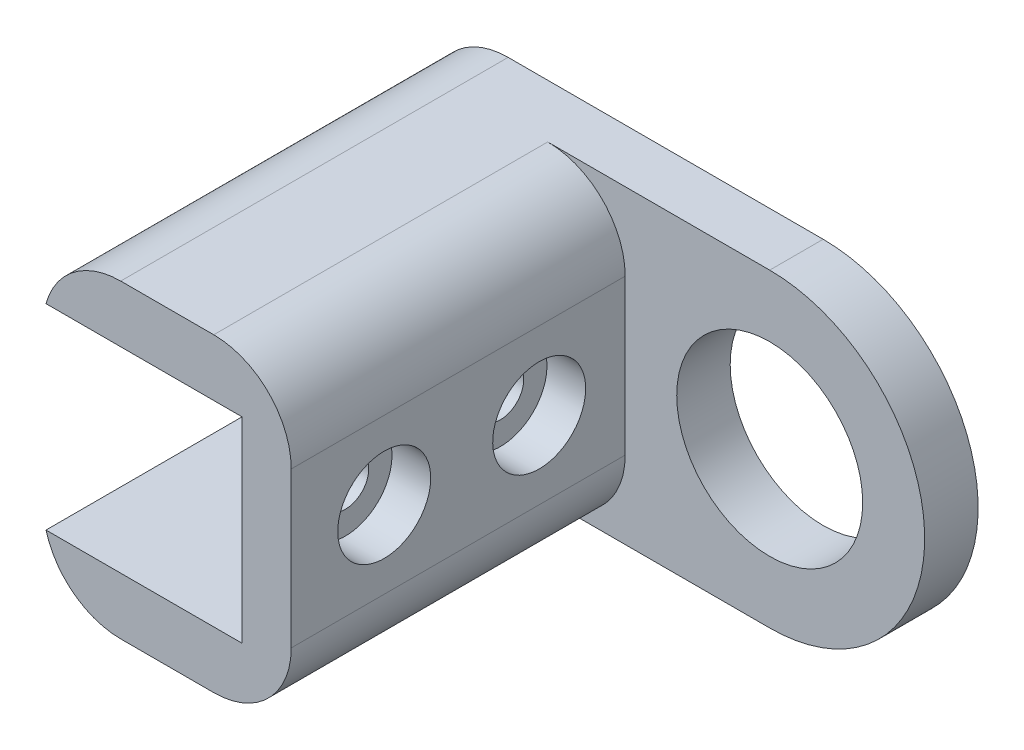
from build123d import *

# Parameters (mm, degrees)
SKETCH1_R           = 6
BOSS_EXTRUDE1_DEPTH = 3.45
SKETCH2_W           = 3.175
SKETCH2_H           = 20
BOSS_EXTRUDE2_DEPTH = 21.55
SKETCH3_W           = 25
SKETCH3_H           = 3.675
BOSS_EXTRUDE3_DEPTH = 12.65
FILLET1_R           = 5
SKETCH5_R           = 1.5
CUT_EXTRUDE1_DEPTH  = 12.65
SKETCH6_R           = 3
CUT_EXTRUDE2_DEPTH  = 2.5
FILLET2_R           = 5


with BuildPart() as part:
    # Sketch1 → Boss-Extrude1 (new body)
    with BuildSketch(Plane.XY):
        with BuildLine():
            Line((0, 10), (-12.5, 10))
            Line((-12.5, 10), (-12.5, -10))
            Line((-12.5, -10), (0, -10))
            ThreePointArc((0, -10), (10, 0), (0, 10))
        make_face()
        with Locations(Location((0, 0, 0), (0, 0, 180))):
            Circle(SKETCH1_R, mode=Mode.SUBTRACT)
    extrude(amount=BOSS_EXTRUDE1_DEPTH)

    # Sketch2 → Boss-Extrude2 (add)
    with BuildSketch(Plane.XY.offset(3.45)):
        with Locations((-10.9125, 0)):
            Rectangle(SKETCH2_W, SKETCH2_H)
    extrude(amount=BOSS_EXTRUDE2_DEPTH)

    # Sketch3 → Boss-Extrude3 (add)
    with BuildSketch(Plane.ZY.offset(12.5)):
        with Locations((12.5, 8.1625)):
            Rectangle(SKETCH3_W, SKETCH3_H)
        with Locations((12.5, -8.1625)):
            Rectangle(SKETCH3_W, SKETCH3_H)
    extrude(amount=BOSS_EXTRUDE3_DEPTH)

    # Fillet1
    fillet1_edges = [part.edges().sort_by_distance(p)[0] for p in [
        (-9.325, 10, 14.225),
        (-9.325, -10, 14.225),
    ]]
    fillet(fillet1_edges, radius=FILLET1_R)

    # Sketch5 → Cut-Extrude1 (cut)
    with BuildSketch(Plane(origin=(-9.325, 0, 0), x_dir=(0, 0, -1), z_dir=(1, 0, 0))):
        with Locations(Location((-19, 0, 0), (0, 0, 90))):
            Circle(SKETCH5_R)
        with Locations(Location((-9, 0, 0), (0, 0, 90))):
            Circle(SKETCH5_R)
    extrude(amount=-CUT_EXTRUDE1_DEPTH, mode=Mode.SUBTRACT)

    # Sketch6 → Cut-Extrude2 (cut)
    with BuildSketch(Plane(origin=(-9.325, 0, 0), x_dir=(0, 0, -1), z_dir=(1, 0, 0))):
        with Locations(Location((-19, 0, 0), (0, 0, 90))):
            Circle(SKETCH6_R)
        with Locations(Location((-9, 0, 0), (0, 0, 90))):
            Circle(SKETCH6_R)
    extrude(amount=-CUT_EXTRUDE2_DEPTH, mode=Mode.SUBTRACT)

    # Fillet2
    # the kernel refuses this fillet: 5 mm, written as the material it takes off along each edge
    with BuildSketch(Plane(origin=(-25.15, 10, 37.05310515), x_dir=(1, 0, 0), z_dir=(0, 0, -1))) as fillet2_piece_1:
        with BuildLine():
            CenterArc((4.82124206, 5), FILLET2_R, 195.366952798, 74.633047202)
            Line((0, 3.675), (-0.096424841, 3.6485))
            ThreePointArc((-0.096424841, 3.6485), (-0.1, 1.8375), (-0.1, 0))
            Line((-0.1, 0), (0, -0.1))
            Line((0, -0.1), (4.82124206, -0.1))
            Line((4.82124206, -0.1), (4.82124206, 0))
        make_face()
    extrude(amount=49.106210299, mode=Mode.SUBTRACT)
    with BuildSketch(Plane(origin=(-25.15, -10, 37.05310515), x_dir=(1, 0, 0), z_dir=(0, 0, -1))) as fillet2_piece_2:
        with BuildLine():
            CenterArc((4.82124206, -5), FILLET2_R, 90, 74.633047202)
            Line((0, -3.675), (-0.096424841, -3.6485))
            ThreePointArc((-0.096424841, -3.6485), (-0.1, -1.8375), (-0.1, 0))
            Line((-0.1, 0), (0, 0.1))
            Line((0, 0.1), (4.82124206, 0.1))
            Line((4.82124206, 0.1), (4.82124206, 0))
        make_face()
    extrude(amount=49.106210299, mode=Mode.SUBTRACT)


solid = part.part
